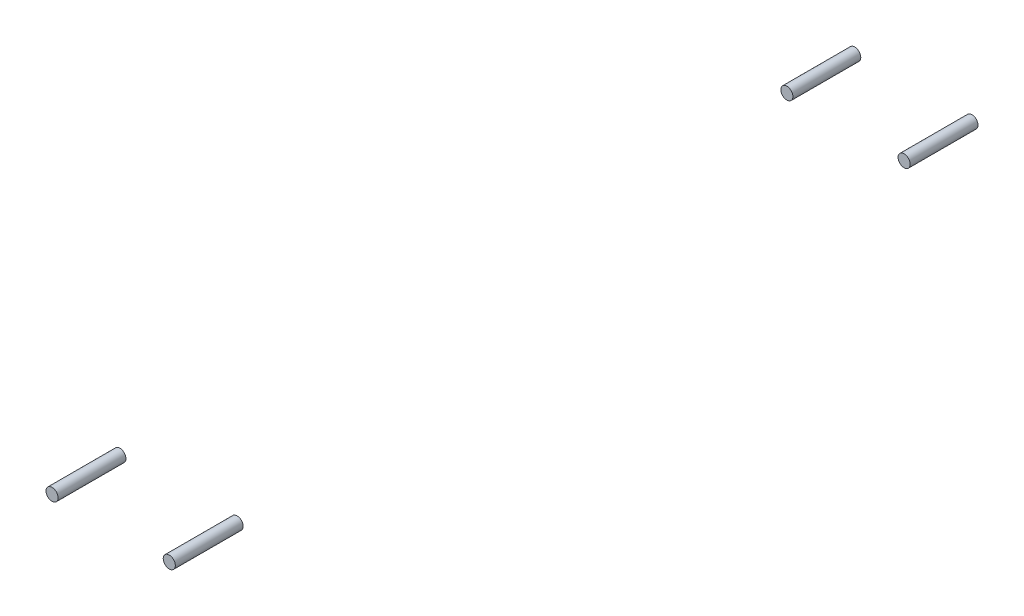
from build123d import *

# Parameters (mm, degrees)
BOSS_EXTRUDE1_START     = -71.1581
BOSS_EXTRUDE1_OUTLINE_R = 6.35
BOSS_EXTRUDE1_DEPTH     = 71.1581
SKETCH3_R               = 6.35
BOSS_EXTRUDE2_DEPTH     = 71.1581
BOSS_EXTRUDE2_2_DEPTH   = 71.1581


# Read off the part's stored shape, not the designer's step: Boss-Extrude1
with BuildPart() as part:
    # Boss-Extrude1 outline → Boss-Extrude1 (new body)
    with BuildSketch(Plane.XY.offset(-722.376).offset(BOSS_EXTRUDE1_START)):
        with Locations((86.868, -20.93468)):
            Circle(BOSS_EXTRUDE1_OUTLINE_R)
        with Locations((-36.068, -20.93468)):
            Circle(BOSS_EXTRUDE1_OUTLINE_R)
    extrude(amount=BOSS_EXTRUDE1_DEPTH)


with BuildPart() as body_2:
    # Sketch3 → Boss-Extrude2 (new body)
    with BuildSketch(Plane(origin=(0, 0, -22.86), x_dir=(-1, 0, 0), z_dir=(0, 0, -1))):
        with Locations((36.068, 0)):
            Circle(SKETCH3_R)
    extrude(amount=-BOSS_EXTRUDE2_DEPTH)


with BuildPart() as body_3:
    # Sketch3 → Boss-Extrude2 2 (new body)
    with BuildSketch(Plane(origin=(0, 0, -22.86), x_dir=(-1, 0, 0), z_dir=(0, 0, -1))):
        with Locations((-86.868, 0)):
            Circle(SKETCH3_R)
    extrude(amount=-BOSS_EXTRUDE2_2_DEPTH)


solid = Compound([part.part, body_2.part, body_3.part])
